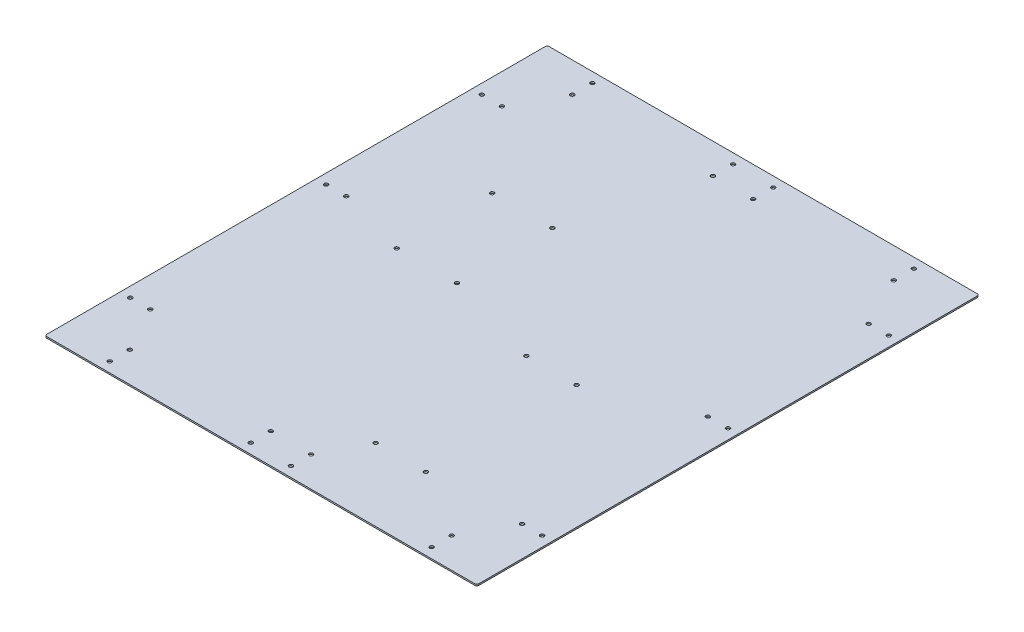
from build123d import *

# Parameters (mm, degrees)
SKETCH1_W           = 430
SKETCH1_H           = 500
BOSS_EXTRUDE1_DEPTH = 1.5
SKETCH12_R          = 1.95
CUT_EXTRUDE3_DEPTH  = 50.8
SKETCH6_R           = 1.95
CUT_EXTRUDE4_DEPTH  = 50.8
SKETCH7_R           = 1.95
CUT_EXTRUDE5_DEPTH  = 50.8
FILLET1_R           = 2


with BuildPart() as part:
    # Sketch1 → Boss-Extrude1 (new body)
    with BuildSketch(Plane(origin=(0, 0, 0), x_dir=(1, 0, 0), z_dir=(0, 1, 0))):
        Rectangle(SKETCH1_W, SKETCH1_H)
    extrude(amount=BOSS_EXTRUDE1_DEPTH)

    # Sketch12 → Cut-Extrude3 (cut)
    with BuildSketch(Plane(origin=(0, 0, 0), x_dir=(-1, 0, 0), z_dir=(0, -1, 0))):
        with Locations((-185, -175)):
            Circle(SKETCH12_R)
        with Locations((-205, 170)):
            Circle(SKETCH12_R)
        with Locations((-185, 10)):
            Circle(SKETCH12_R)
        with Locations((-205, 10)):
            Circle(SKETCH12_R)
        with Locations((-205, -175)):
            Circle(SKETCH12_R)
        with Locations((-185, 170)):
            Circle(SKETCH12_R)
        with Locations((205, -175)):
            Circle(SKETCH12_R)
        with Locations((205, 20)):
            Circle(SKETCH12_R)
        with Locations((185, 175)):
            Circle(SKETCH12_R)
        with Locations((205, 175)):
            Circle(SKETCH12_R)
        with Locations((185, -175)):
            Circle(SKETCH12_R)
        with Locations((185, 20)):
            Circle(SKETCH12_R)
        with Locations((160.349922153, -240)):
            Circle(SKETCH12_R)
        with Locations((160.349922153, -220)):
            Circle(SKETCH12_R)
        with Locations((20, -240)):
            Circle(SKETCH12_R)
        with Locations((20, -220)):
            Circle(SKETCH12_R)
        with Locations((-20, -220)):
            Circle(SKETCH12_R)
        with Locations((-20, -240)):
            Circle(SKETCH12_R)
        with Locations((-160, -240)):
            Circle(SKETCH12_R)
        with Locations((-160, -220)):
            Circle(SKETCH12_R)
        with Locations((160, 220)):
            Circle(SKETCH12_R)
        with Locations((160, 240)):
            Circle(SKETCH12_R)
        with Locations((20, 220)):
            Circle(SKETCH12_R)
        with Locations((20, 240)):
            Circle(SKETCH12_R)
        with Locations((-20, 220)):
            Circle(SKETCH12_R)
        with Locations((-20, 240)):
            Circle(SKETCH12_R)
        with Locations((-160, 220)):
            Circle(SKETCH12_R)
        with Locations((-160, 240)):
            Circle(SKETCH12_R)
    extrude(amount=-CUT_EXTRUDE3_DEPTH, mode=Mode.SUBTRACT)

    # Sketch6 → Cut-Extrude4 (cut)
    with BuildSketch(Plane(origin=(0, 1.5, 0), x_dir=(1, 0, 0), z_dir=(0, 1, 0))):
        with Locations((92.292697989, -28)):
            Circle(SKETCH6_R)
        with Locations((42.292697989, -28)):
            Circle(SKETCH6_R)
        with Locations((92.292697989, -178)):
            Circle(SKETCH6_R)
        with Locations((42.292697989, -178)):
            Circle(SKETCH6_R)
    extrude(amount=-CUT_EXTRUDE4_DEPTH, mode=Mode.SUBTRACT)

    # Sketch7 → Cut-Extrude5 (cut)
    with BuildSketch(Plane(origin=(0, 1.5, 0), x_dir=(1, 0, 0), z_dir=(0, 1, 0))):
        with Locations((-114.979961576, 95.192396061)):
            Circle(SKETCH7_R)
        with Locations((-54.979961576, 95.192396061)):
            Circle(SKETCH7_R)
        with Locations((-54.979961576, 0.192396061)):
            Circle(SKETCH7_R)
        with Locations((-114.979961576, 0.192396061)):
            Circle(SKETCH7_R)
    extrude(amount=-CUT_EXTRUDE5_DEPTH, mode=Mode.SUBTRACT)

    # Fillet1
    fillet1_edges = [part.edges().sort_by_distance(p)[0] for p in [
        (215, 0.75, -250),
        (215, 0.75, 250),
        (-215, 0.75, 250),
        (-215, 0.75, -250),
    ]]
    fillet(fillet1_edges, radius=FILLET1_R)


solid = part.part
